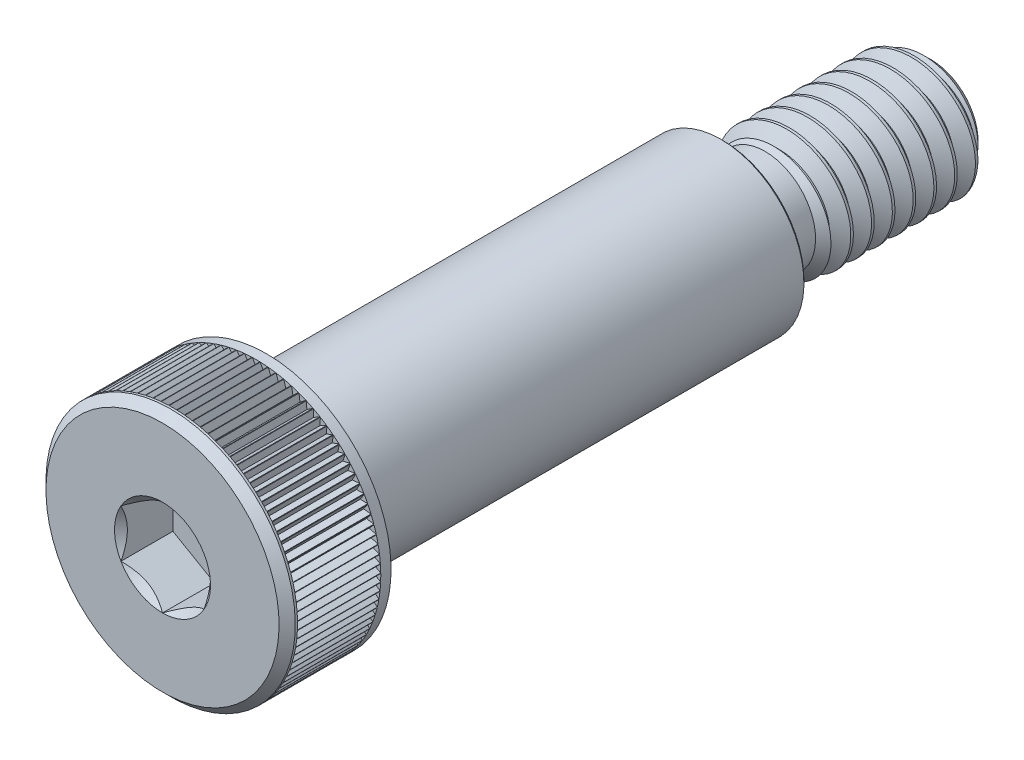
from build123d import *

# Parameters (mm, degrees)
CHAMFER1_SIZE      = 1.190625
CHAMFER2_SIZE      = 0.619125
CHAMFER3_SIZE      = 0.2032
CUT_EXTRUDE5_DEPTH = 3.18214375
CIRPATTERN1_COUNT  = 99
CUT_EXTRUDE2_DEPTH = 3.96875
CUT_SWEEP1_PITCH   = 1.5875


with BuildPart() as part:
    # Sketch1 → Revolve1 (revolve)
    with BuildSketch(Plane(origin=(0, 0, 0), x_dir=(0, 0, -1), z_dir=(1, 0, 0))):
        Polygon((0, 9.525), (7.9375, 9.525), (7.9375, 6.35), (42.8625, 6.35), (42.8625, 4.7625), (58.7375, 4.7625), (58.7375, 0), (0, 0), align=None)
    revolve(axis=Axis((0, 0, -58.7375), (0, 0, 1)))

    # Sketch5 → Cut-Revolve1 (revolve, cut)
    with BuildSketch(Plane(origin=(0, 0, 0), x_dir=(0, 0, -1), z_dir=(1, 0, 0))):
        with BuildLine():
            Line((42.8625, 6.35), (48.5267, 6.35))
            Line((48.5267, 6.35), (46.0375, 3.8608))
            Line((46.0375, 3.8608), (43.7642, 3.8608))
            ThreePointArc((43.7642, 3.8608), (43.126601815, 4.124901815), (42.8625, 4.7625))
            Line((42.8625, 4.7625), (42.8625, 6.35))
        make_face()
    revolve(axis=Axis((0, 0, -58.7375), (0, 0, 1)), mode=Mode.SUBTRACT)

    # Chamfer1
    chamfer1_edges = [part.edges().sort_by_distance(p)[0] for p in [
        (0, -4.7625, -58.7375),
    ]]
    chamfer(chamfer1_edges, length=CHAMFER1_SIZE)

    # Chamfer2
    chamfer2_edges = [part.edges().sort_by_distance(p)[0] for p in [
        (0, -9.525, 0),
    ]]
    chamfer(chamfer2_edges, length=CHAMFER2_SIZE)

    # Chamfer3
    chamfer3_edges = [part.edges().sort_by_distance(p)[0] for p in [
        (0, -6.35, -42.8625),
    ]]
    chamfer(chamfer3_edges, length=CHAMFER3_SIZE)

    # Sketch11 → Cut-Extrude5 (cut, symmetric)
    with BuildSketch(Plane.XY.offset(-3.96875)):
        Polygon((0, 9.0297), (0.285961588, 9.525), (-0.285961588, 9.525), align=None)
    cut_extrude5 = extrude(amount=CUT_EXTRUDE5_DEPTH, both=True, mode=Mode.SUBTRACT)

    # CirPattern1: Cut-Extrude5 ×99 about axis
    cirpattern1_axis = Axis((0, 0, 0), (0, 0, 1))
    for i in range(1, CIRPATTERN1_COUNT):
        add(cut_extrude5.rotate(cirpattern1_axis, i * 360 / CIRPATTERN1_COUNT), mode=Mode.SUBTRACT)

    # Sketch8 → Cut-Extrude2 (cut)
    with BuildSketch(Plane.XY):
        Polygon((3.175, 1.833087105), (0, 3.666174209), (-3.175, 1.833087105), (-3.175, -1.833087105), (0, -3.666174209), (3.175, -1.833087105), align=None)
    extrude(amount=-CUT_EXTRUDE2_DEPTH, mode=Mode.SUBTRACT)

    # Cut-Extrude4 cone 1 section (through the dimple's axis) → Cut-Extrude4 (revolve, cut)
    with BuildSketch(Plane(origin=(0, 0, 0), x_dir=(0, -1, 0), z_dir=(1, 0, 0))):
        Polygon((0, 0), (3.666174209, 0), (0, 3.666174209), align=None)
    revolve(axis=Axis((0, 0, 0), (0, 0, -1)), mode=Mode.SUBTRACT)

    # Cut-Sweep1: the profile of Sketch4 screwed along a right-hand helix of 11 turns, 8 arcs to a turn; built about Z, then put on its axis
    cut_sweep1_z = Axis((0, 0, 0), (0, 0, 1))
    cut_sweep1_corners = [(4.848425958, 0, 0.049609375), (4.848425958, 0, -1.438671875), (3.731388504, 0, -0.79375), (3.731388504, 0, -0.5953125)]
    with BuildLine(mode=Mode.PRIVATE) as cut_sweep1_profile:
        Line(cut_sweep1_corners[0], cut_sweep1_corners[1])
        Line(cut_sweep1_corners[1], cut_sweep1_corners[2])
        Line(cut_sweep1_corners[2], cut_sweep1_corners[3])
        Line(cut_sweep1_corners[3], cut_sweep1_corners[0])
    cut_sweep1_cap = Face(cut_sweep1_profile.wire())
    cut_sweep1_turn_angles = [0, 22.5, 45, 67.5, 90, 112.5, 135, 157.5, 180, 202.5, 225, 247.5, 270, 292.5, 315, 337.5, 360]
    cut_sweep1_turn_weights = [1, 0.9238795325112867, 1, 0.9238795325112867, 1, 0.9238795325112867, 1, 0.9238795325112867, 1, 0.9238795325112867, 1, 0.9238795325112867, 1, 0.9238795325112867, 1, 0.9238795325112867, 1]
    cut_sweep1_turn_rails = [Edge.make_bspline([Vector(p[0], p[1], 0).rotate(cut_sweep1_z, cut_sweep1_turn_angles[k]) / cut_sweep1_turn_weights[k] + Vector(0, 0, p[2] + CUT_SWEEP1_PITCH * cut_sweep1_turn_angles[k] / 360) for k in range(17)], [0, 0, 0, 1, 1, 2, 2, 3, 3, 4, 4, 5, 5, 6, 6, 7, 7, 8, 8, 8], 2, cut_sweep1_turn_weights) for p in cut_sweep1_corners]
    cut_sweep1_turn_sides = [Face.make_surface_from_curves(cut_sweep1_turn_rails[p[0]], cut_sweep1_turn_rails[p[1]]) for p in [(0, 1), (1, 2), (2, 3), (3, 0)]]
    cut_sweep1 = Plane(origin=(0, 0, -58.7375), x_dir=(0, 1, 0), z_dir=(0, 0, 1)) * Solid(Shell([*[p.moved(Location((0, 0, CUT_SWEEP1_PITCH * i))) for i in range(11) for p in cut_sweep1_turn_sides], cut_sweep1_cap, cut_sweep1_cap.rotate(cut_sweep1_z, 3960).moved(Location((0, 0, CUT_SWEEP1_PITCH * 3960 / 360)))]))
    add(cut_sweep1, mode=Mode.SUBTRACT)

    # Sketch12 → Revolve2 (revolve)
    with BuildSketch(Plane(origin=(0, 0, 0), x_dir=(0, 0, -1), z_dir=(1, 0, 0)), mode=Mode.PRIVATE) as revolve2_sk:
        with BuildLine():
            Line((42.8625, 6.1468), (42.6593, 6.35))
            Line((42.6593, 6.35), (7.9375, 6.35))
            Line((7.9375, 6.35), (7.9375, 0))
            Line((7.9375, 0), (42.8625, 0))
            Line((42.8625, 0), (46.0375, 0))
            Line((46.0375, 0), (46.0375, 3.8608))
            Line((46.0375, 3.8608), (43.7642, 3.8608))
            ThreePointArc((43.7642, 3.8608), (43.126601815, 4.124901815), (42.8625, 4.7625))
            Line((42.8625, 4.7625), (42.8625, 6.1468))
        make_face()
    revolve(revolve2_sk.sketch.rotate(Axis((0, 0, -7.9375), (0, 0, -1)), 189.052465709), axis=Axis((0, 0, -7.9375), (0, 0, -1)))


solid = part.part
